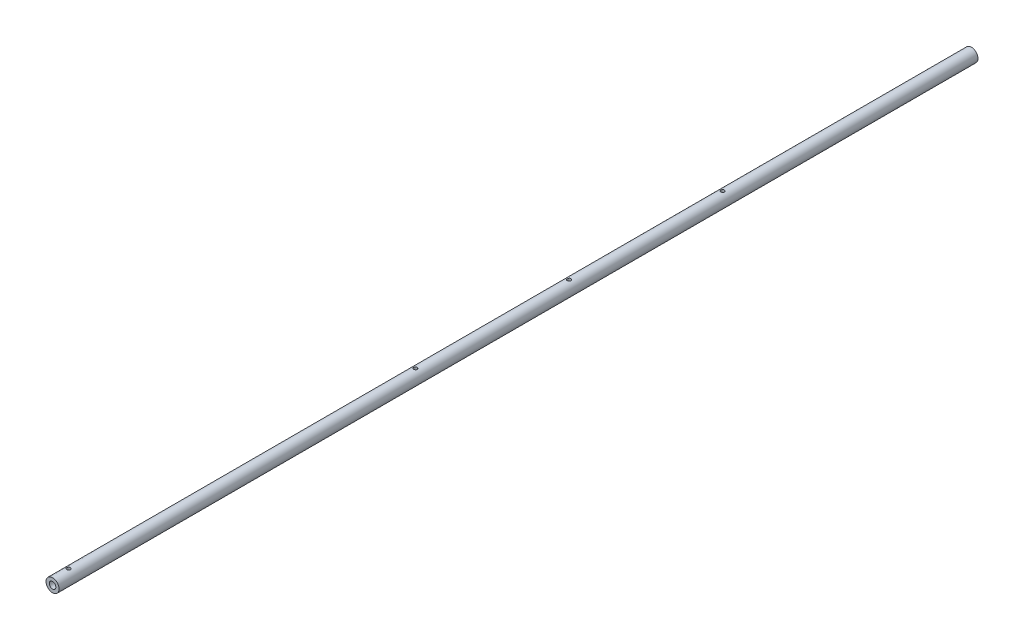
from build123d import *

# Parameters (mm, degrees)
SKETCH1_R        = 7.8613
SKETCH1_R_2      = 3.93065
ROD_DEPTH        = 1101.725
HOLES_DEPTH      = 1102.781092459
HOLES_DEPTH_BACK = 1102.781092459
SKETCH3_R        = 2.1082


with BuildPart() as part:
    # Sketch1 → Rod (new body)
    with BuildSketch(Plane.XY):
        Circle(SKETCH1_R)
        Circle(SKETCH1_R_2, mode=Mode.SUBTRACT)
    extrude(amount=ROD_DEPTH)

    # Sketch3 → Holes (cut, two sides: drawn at the far end of the back side and taken through both)
    with BuildSketch(Plane(origin=(0, 0, 0), x_dir=(1, 0, 0), z_dir=(0, 1, 0)).offset(-HOLES_DEPTH_BACK)):
        with Locations((0, -298.45)):
            Circle(SKETCH3_R)
        with Locations((0, -482.6)):
            Circle(SKETCH3_R)
        with Locations((0, -666.75)):
            Circle(SKETCH3_R)
        with Locations((0, -1082.675)):
            Circle(SKETCH3_R)
    extrude(amount=HOLES_DEPTH + HOLES_DEPTH_BACK, mode=Mode.SUBTRACT)


solid = part.part
